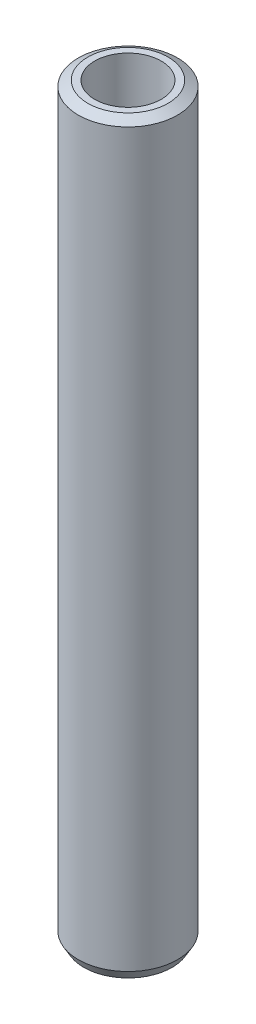
from build123d import *
from OCP.BRepFilletAPI import BRepFilletAPI_MakeChamfer

# Parameters (mm, degrees)
SKETCH1_R           = 27.5
BOSS_EXTRUDE1_DEPTH = 413.705561088
SKETCH2_R           = 18.434984334
CUT_EXTRUDE1_DEPTH  = 416.529531171
CHAMFER1_SIZE       = 3.036217861
CHAMFER1_SIZE2      = 5.258883598


with BuildPart() as part:
    # Sketch1 → Boss-Extrude1 (new body)
    with BuildSketch(Plane(origin=(0, 0, 0), x_dir=(1, 0, 0), z_dir=(0, 1, 0))):
        Circle(SKETCH1_R)
    extrude(amount=BOSS_EXTRUDE1_DEPTH)

    # Sketch2 → Cut-Extrude1 (cut, through all)
    with BuildSketch(Plane(origin=(0, 0, 0), x_dir=(1, 0, 0), z_dir=(0, 1, 0))):
        Circle(SKETCH2_R)
    extrude(amount=CUT_EXTRUDE1_DEPTH, mode=Mode.SUBTRACT)

    # Chamfer1: one chamfer whose edges measure the first distance from different faces: ONE call of the kernel's chamfer builder (chamfer() names one face for all edges)
    chamfer1_edges_1 = [part.edges().sort_by_distance(p)[0] for p in [
        (-27.5, 413.705561088, 0),
    ]]
    chamfer1_side_1 = [part.faces().sort_by_distance(p)[0] for p in [
        (-27.5, 206.852780544, 0),
    ]]
    chamfer1_edges_2 = [part.edges().sort_by_distance(p)[0] for p in [
        (-27.5, 0, 0),
    ]]
    chamfer1_side_2 = [part.faces().sort_by_distance(p)[0] for p in [
        (-26.722182541, 0, 0),
    ]]
    chamfer1 = BRepFilletAPI_MakeChamfer(part.part.solid().wrapped)
    for e in chamfer1_edges_1:
        chamfer1.Add(CHAMFER1_SIZE, CHAMFER1_SIZE2, e.wrapped, chamfer1_side_1[0].wrapped)  # the first distance lies on this face
    for e in chamfer1_edges_2:
        chamfer1.Add(CHAMFER1_SIZE, CHAMFER1_SIZE2, e.wrapped, chamfer1_side_2[0].wrapped)  # the first distance lies on this face
    add(Compound.cast(chamfer1.Shape()), mode=Mode.REPLACE)


solid = part.part
